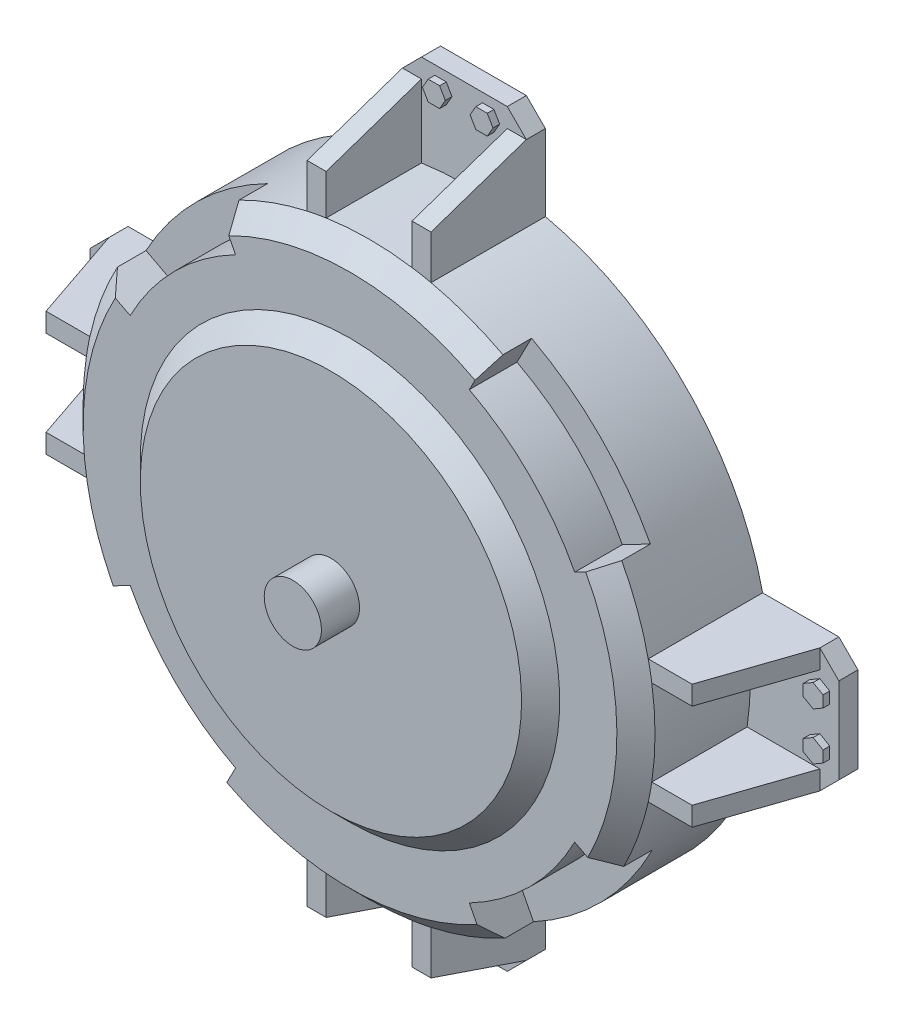
from build123d import *

# Parameters (mm, degrees)
SKETCH1_R                    = 150
BOSS_EXTRUDE1_DEPTH          = 70
CHAMFER1_SIZE                = 10
BOSS_EXTRUDE2_START          = -70
BOSS_EXTRUDE2_DEPTH          = 10
CHAMFER2_SIZE                = 10
BOSS_EXTRUDE3_DEPTH          = 10
BOSS_EXTRUDE4_DEPTH          = 3.5
CIRPATTERN1_COUNT            = 4
CIRPATTERN1_COPY_1_DEPTH     = 10
CIRPATTERN1_COPY_2_DEPTH     = 10
CIRPATTERN1_COPY_3_DEPTH     = 10
CIRPATTERN1_COPY_4_DEPTH     = 3.5
CIRPATTERN1_COPY_5_DEPTH     = 3.5
CIRPATTERN1_COPY_6_DEPTH     = 3.5
CHAMFER2_OF_CIRPATTERN1_SIZE = 10
CUT_EXTRUDE1_START           = -25
CUT_EXTRUDE1_DEPTH           = 25
CIRPATTERN2_COUNT            = 4
SKETCH6_R                    = 110
BOSS_EXTRUDE5_DEPTH          = 10
CHAMFER3_SIZE                = 10
SKETCH8_R                    = 15
BOSS_EXTRUDE6_DEPTH          = 20
BODY_MOVE_COPY2_ANGLE        = 90


with BuildPart() as part:
    # Sketch1 → Boss-Extrude1 (new body)
    with BuildSketch(Plane(origin=(0, 0, 0), x_dir=(1, 0, 0), z_dir=(0, 1, 0))):
        with Locations(Location((0, 0, 0), (0, 0, 270))):
            Circle(SKETCH1_R)
    extrude(amount=BOSS_EXTRUDE1_DEPTH)

    # Chamfer1
    chamfer1_edges = [part.edges().sort_by_distance(p)[0] for p in [
        (0, 70, -150),
    ]]
    chamfer(chamfer1_edges, length=CHAMFER1_SIZE)

    # Sketch2 → Boss-Extrude2 (add)
    with BuildSketch(Plane(origin=(0, 70, 0), x_dir=(1, 0, 0), z_dir=(0, 1, 0)).offset(BOSS_EXTRUDE2_START)):
        with BuildLine():
            Line((-146.436846456, 32.5), (-196.436846456, 32.5))
            Line((-196.436846456, 32.5), (-196.436846456, -32.5))
            Line((-196.436846456, -32.5), (-146.436846456, -32.5))
            ThreePointArc((-146.436846456, -32.5), (-150, 0), (-146.436846456, 32.5))
        make_face()
    boss_extrude2 = extrude(amount=BOSS_EXTRUDE2_DEPTH)

    # Chamfer2
    chamfer2_edges = [part.edges().sort_by_distance(p)[0] for p in [
        (-196.436846456, 5, -32.5),
        (-196.436846456, 5, 32.5),
    ]]
    chamfer(chamfer2_edges, length=CHAMFER2_SIZE)

    # Sketch3 → Boss-Extrude3 (add)
    with BuildSketch(Plane.XY.offset(32.5)):
        Polygon((-146.436846456, 10), (-146.436846456, 60), (-169.436846456, 60), (-186.436846456, 10), align=None)
    boss_extrude3 = extrude(amount=-BOSS_EXTRUDE3_DEPTH)

    # Sketch4 → Boss-Extrude4 (add)
    with BuildSketch(Plane(origin=(0, 10, 0), x_dir=(1, 0, 0), z_dir=(0, 1, 0))):
        Polygon((-186.436846456, -6.5), (-191.632998879, -9.5), (-191.632998879, -15.5), (-186.436846456, -18.5), (-181.240694033, -15.5), (-181.240694033, -9.5), align=None)
    boss_extrude4 = extrude(amount=BOSS_EXTRUDE4_DEPTH)

    # Mirror1: Boss-Extrude3, Boss-Extrude4 across plane
    add(boss_extrude3.mirror(Plane.XY))
    add(boss_extrude4.mirror(Plane.XY))

    # CirPattern1: Boss-Extrude2, Boss-Extrude3, Boss-Extrude4 ×4 about axis
    cirpattern1_axis = Axis((0, 0, 0), (0, 1, 0))
    add([boss_extrude2.rotate(cirpattern1_axis, i * 360 / CIRPATTERN1_COUNT) for i in range(1, CIRPATTERN1_COUNT)])
    add([boss_extrude3.rotate(cirpattern1_axis, i * 360 / CIRPATTERN1_COUNT) for i in range(1, CIRPATTERN1_COUNT)])
    add([boss_extrude4.rotate(cirpattern1_axis, i * 360 / CIRPATTERN1_COUNT) for i in range(1, CIRPATTERN1_COUNT)])

    # CirPattern1 copy 1 sketch → CirPattern1 copy 1 (add)
    with BuildSketch(Plane(origin=(-32.5, 0, 0), x_dir=(0, 0, -1), z_dir=(-1, 0, 0))):
        Polygon((-146.436846456, -10), (-146.436846456, -60), (-169.436846456, -60), (-186.436846456, -10), align=None)
    extrude(amount=-CIRPATTERN1_COPY_1_DEPTH)

    # CirPattern1 copy 2 sketch → CirPattern1 copy 2 (add)
    with BuildSketch(Plane(origin=(0, 0, 32.5), x_dir=(-1, 0, 0), z_dir=(0, 0, 1))):
        Polygon((-146.436846456, -10), (-146.436846456, -60), (-169.436846456, -60), (-186.436846456, -10), align=None)
    extrude(amount=-CIRPATTERN1_COPY_2_DEPTH)

    # CirPattern1 copy 3 sketch → CirPattern1 copy 3 (add)
    with BuildSketch(Plane(origin=(32.5, 0, 0), x_dir=(0, 0, 1), z_dir=(1, 0, 0))):
        Polygon((-146.436846456, -10), (-146.436846456, -60), (-169.436846456, -60), (-186.436846456, -10), align=None)
    extrude(amount=-CIRPATTERN1_COPY_3_DEPTH)

    # CirPattern1 copy 4 sketch → CirPattern1 copy 4 (add)
    with BuildSketch(Plane(origin=(0, 10, 0), x_dir=(0, 0, -1), z_dir=(0, 1, 0))):
        Polygon((-186.436846456, 6.5), (-191.632998879, 9.5), (-191.632998879, 15.5), (-186.436846456, 18.5), (-181.240694033, 15.5), (-181.240694033, 9.5), align=None)
    extrude(amount=CIRPATTERN1_COPY_4_DEPTH)

    # CirPattern1 copy 5 sketch → CirPattern1 copy 5 (add)
    with BuildSketch(Plane(origin=(0, 10, 0), x_dir=(-1, 0, 0), z_dir=(0, 1, 0))):
        Polygon((-186.436846456, 6.5), (-191.632998879, 9.5), (-191.632998879, 15.5), (-186.436846456, 18.5), (-181.240694033, 15.5), (-181.240694033, 9.5), align=None)
    extrude(amount=CIRPATTERN1_COPY_5_DEPTH)

    # CirPattern1 copy 6 sketch → CirPattern1 copy 6 (add)
    with BuildSketch(Plane.ZX.offset(10)):
        Polygon((-186.436846456, 6.5), (-191.632998879, 9.5), (-191.632998879, 15.5), (-186.436846456, 18.5), (-181.240694033, 15.5), (-181.240694033, 9.5), align=None)
    extrude(amount=CIRPATTERN1_COPY_6_DEPTH)

    # Chamfer2 of CirPattern1
    chamfer2_of_cirpattern1_edges = [part.edges().sort_by_distance(p)[0] for p in [
        (-32.5, 5, 196.436846456),
        (32.5, 5, 196.436846456),
        (196.436846456, 5, 32.5),
        (196.436846456, 5, -32.5),
        (32.5, 5, -196.436846456),
        (-32.5, 5, -196.436846456),
    ]]
    chamfer(chamfer2_of_cirpattern1_edges, length=CHAMFER2_OF_CIRPATTERN1_SIZE)

    # Sketch5 → Cut-Extrude1 (cut)
    with BuildSketch(Plane(origin=(0, 70, 0), x_dir=(1, 0, 0), z_dir=(0, 1, 0)).offset(CUT_EXTRUDE1_START)):
        with BuildLine():
            Line((-115.311408313, -60.027319721), (-133.051624977, -69.262291985))
            ThreePointArc((-133.051624977, -69.262291985), (-106.066017178, -106.066017178), (-69.262291985, -133.051624977))
            Line((-69.262291985, -133.051624977), (-60.027319721, -115.311408313))
            ThreePointArc((-60.027319721, -115.311408313), (-91.923881554, -91.923881554), (-115.311408313, -60.027319721))
        make_face()
    cut_extrude1 = extrude(amount=CUT_EXTRUDE1_DEPTH, mode=Mode.SUBTRACT)

    # CirPattern2: Cut-Extrude1 ×4 about axis
    cirpattern2_axis = Axis((1.276358498, 0, -1.276358498), (0, 1, 0))
    for i in range(1, CIRPATTERN2_COUNT):
        add(cut_extrude1.rotate(cirpattern2_axis, i * 360 / CIRPATTERN2_COUNT), mode=Mode.SUBTRACT)

    # Sketch6 → Boss-Extrude5 (add)
    with BuildSketch(Plane(origin=(0, 70, 0), x_dir=(1, 0, 0), z_dir=(0, 1, 0))):
        with Locations(Location((0, 0, 0), (0, 0, 270))):
            Circle(SKETCH6_R)
    extrude(amount=BOSS_EXTRUDE5_DEPTH)

    # Chamfer3
    chamfer3_edges = [part.edges().sort_by_distance(p)[0] for p in [
        (0, 80, -110),
    ]]
    chamfer(chamfer3_edges, length=CHAMFER3_SIZE - 0.0001)  # a hair under: the kernel refuses the full size

    # Sketch8 → Boss-Extrude6 (add)
    with BuildSketch(Plane(origin=(0, 80, 0), x_dir=(1, 0, 0), z_dir=(0, 1, 0))):
        with Locations(Location((0, 0, 0), (0, 0, 270))):
            Circle(SKETCH8_R)
    extrude(amount=BOSS_EXTRUDE6_DEPTH)


with BuildPart() as part_1:
    # Body-Move/Copy1: moved
    add(part.part.moved(Location((0, -99.99999995, 0))))


with BuildPart() as part_2:
    # Body-Move/Copy2: read off the stored shape, not the designer's step
    # Body-Move/Copy2: moved
    add(part_1.part.moved(Location((0, 50, 50))).rotate(Axis((0, 0, 0), (1, 0, 0)), BODY_MOVE_COPY2_ANGLE))


with BuildPart() as part_3:
    # Body-Move/Copy3: moved
    add(part_2.part.moved(Location((0, 50, -50))))


with BuildPart() as part_4:
    # Body-Move/Copy4: moved
    add(part_3.part.moved(Location((0, 0, 20))))


with BuildPart() as part_5:
    # Body-Move/Copy6: moved
    add(part_4.part.moved(Location((0, 0, 80))))


solid = part_5.part
